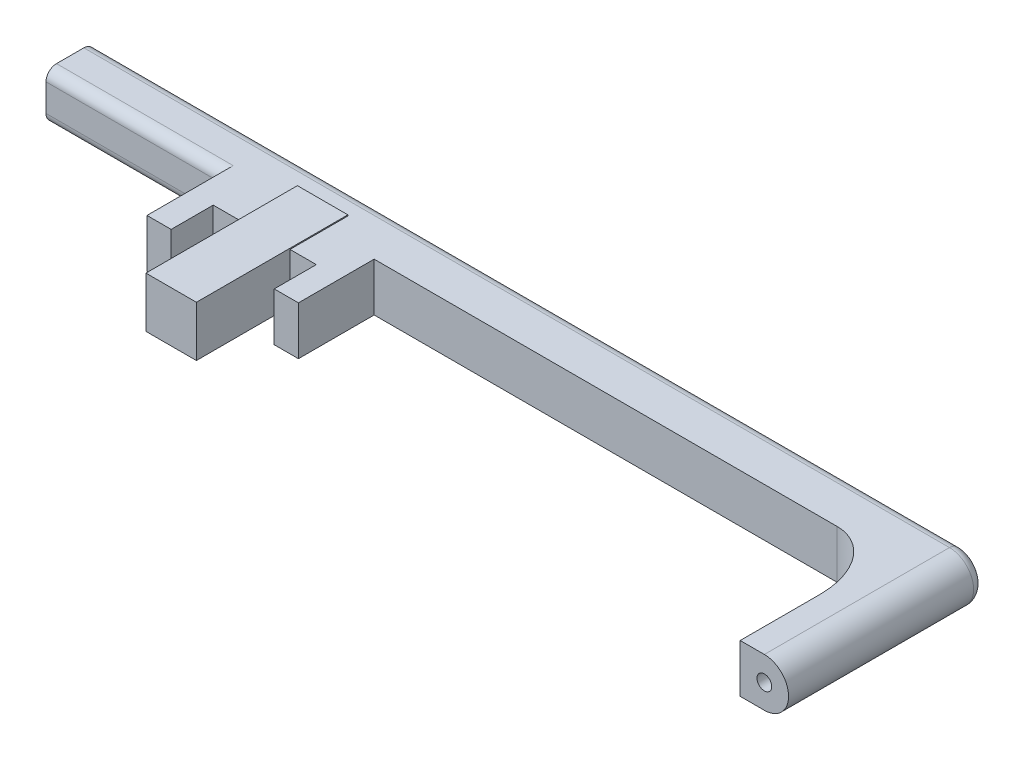
from build123d import *

# Parameters (mm, degrees)
SKETCH_1_W           = 2.4
SKETCH_1_H           = 2.4
EXTRUDE_1_DEPTH      = 7.2
EXTRUDE_2_DEPTH      = 28
EXTRUDE_2_DEPTH_BACK = 12
SKETCH_4_W           = 2.3
SKETCH_4_H           = 2.3
EXTRUDE_3_DEPTH      = 7
EXTRUDE_3_DEPTH_BACK = 2.3
SKETCH_5_R           = 0.35
SKETCH_6_R           = 0.35
CUT_EXTRUDE_1_DEPTH  = 10
FILLET_1_SIZE        = 2.4
FILLET_1_SIZE_2      = 3.2
FILLET_2_R           = 0.5
EXTRUDE_START        = -1.5
SKETCH_7_W           = 1.15
SKETCH_7_H           = 0.5
SKETCH_7_H_2         = 1.3
SKETCH_7_H_3         = 2.3
EXTRUDE_4_DEPTH      = 5.1
SKETCH_8_W           = 7.2
SKETCH_8_H           = 2.3
EXTRUDE_5_DEPTH      = 3.1


with BuildPart() as part:
    # 草图1 → 凸台-拉伸1 (new body)
    with BuildSketch(Plane.XY):
        Rectangle(SKETCH_1_W, SKETCH_1_H)
    extrude(amount=EXTRUDE_1_DEPTH)

    # 草图4 → 凸台-拉伸2 (add, two sides: drawn at the far end of the back side and taken through both)
    with BuildSketch(Plane(origin=(0, 0, 0), x_dir=(0, 0, -1), z_dir=(1, 0, 0)).offset(-EXTRUDE_2_DEPTH_BACK)):
        Rectangle(SKETCH_4_W, SKETCH_4_H)
    extrude(amount=EXTRUDE_2_DEPTH + EXTRUDE_2_DEPTH_BACK)

    # 草图5 → 凸台-拉伸3 (add, two sides: drawn at the far end of the back side and taken through both)
    with BuildSketch(Plane.XY.offset(1.15).offset(-EXTRUDE_3_DEPTH_BACK)):
        with BuildLine():
            Line((28, 0), (28, 1.15))
            Line((28, 1.15), (29.15, 1.15))
            ThreePointArc((29.15, 1.15), (30.3, 0), (29.15, -1.15))
            Line((29.15, -1.15), (28, -1.15))
            Line((28, -1.15), (28, 0))
        make_face()
        with Locations(Location((29.15, 0, 0), (0, 0, 180))):
            Circle(SKETCH_5_R, mode=Mode.SUBTRACT)
    extrude(amount=EXTRUDE_3_DEPTH + EXTRUDE_3_DEPTH_BACK)

    # 草图6 → 切除-拉伸1 (cut)
    with BuildSketch(Plane.ZY.offset(12)):
        Circle(SKETCH_6_R)
    extrude(amount=-CUT_EXTRUDE_1_DEPTH, mode=Mode.SUBTRACT)

    # 圆角1
    # an asymmetric fillet: 3.2, 2.4 mm, written as the material it adds along each edge
    with BuildSketch(Plane(origin=(28, 1.15, 1.15), x_dir=(-1, 0, 0), z_dir=(0, -1, 0))) as fillet_1_piece_1:
        with BuildLine():
            Bezier((FILLET_1_SIZE, 0), (0, 0), (0, -FILLET_1_SIZE_2), weights=[1, 0.707106781, 1])
            Line((0, -FILLET_1_SIZE_2), (0, 0))
            Line((0, 0), (FILLET_1_SIZE, 0))
        make_face()
    extrude(amount=2.3)

    # 圆角2
    fillet_2_edges = [part.edges().sort_by_distance(p)[0] for p in [
        (-6.6, -1.15, 1.15),
        (8.575, -1.15, -1.15),
        (-6.6, 1.15, 1.15),
        (8.575, 1.15, -1.15),
        (30.3, 0, -1.15),
    ]]
    fillet(fillet_2_edges, radius=FILLET_2_R)

    # 草图7 → 凸台-拉伸4 (add)
    with BuildSketch(Plane.XY.offset(1.15).offset(EXTRUDE_START)):
        with Locations((-3.025, 0.9)):
            Rectangle(SKETCH_7_W, SKETCH_7_H)
        with Locations((-3.025, 0)):
            Rectangle(SKETCH_7_W, SKETCH_7_H_2)
        with Locations((-3.025, -0.9)):
            Rectangle(SKETCH_7_W, SKETCH_7_H)
        with Locations((3.025, 0)):
            Rectangle(SKETCH_7_W, SKETCH_7_H_3)
    extrude(amount=EXTRUDE_4_DEPTH)

    # 草图8 → 凸台-拉伸5 (add)
    with BuildSketch(Plane.XY.offset(1.15).offset(EXTRUDE_START)):
        Rectangle(SKETCH_8_W, SKETCH_8_H)
    extrude(amount=EXTRUDE_5_DEPTH)


solid = part.part
